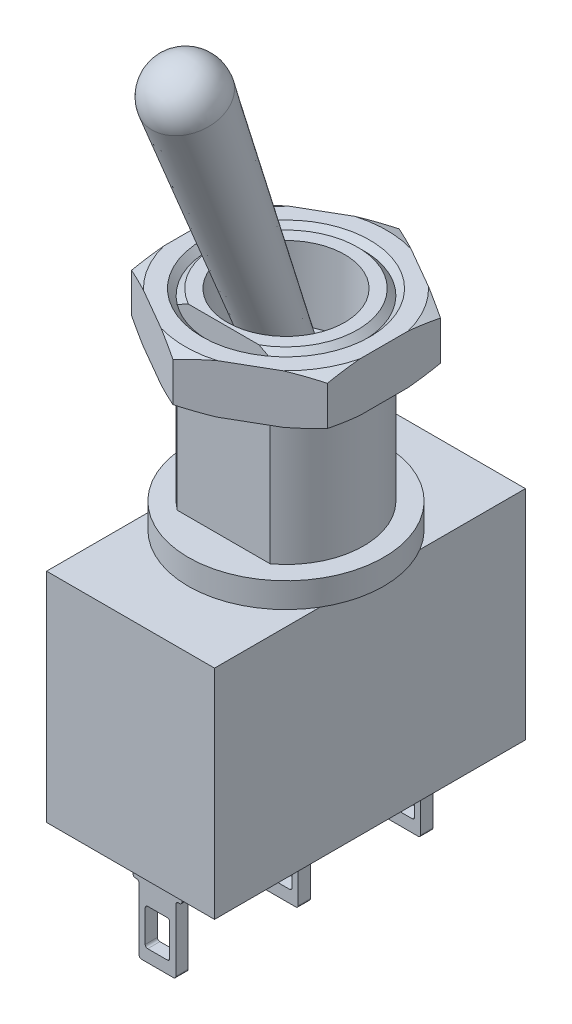
from build123d import *

# Parameters (mm, degrees)
EXTRUDE1_DEPTH             = 3.43
EXTRUDE1_DEPTH_BACK        = 3.43
SKETCH1_W                  = 12.7
SKETCH1_H                  = 8.89
SKETCH2_R                  = 3.99
EXTRUDE2_DEPTH             = 1.02
SKETCH3_R                  = 3.175
EXTRUDE3_DEPTH             = 7.52
CHAMFER1_SIZE              = 0.25
SKETCH7_R                  = 2.4
CUT_EXTRUDE2_DEPTH         = 3
SKETCH4_W                  = 3.796630084
SKETCH4_H                  = 2.50209529
CUT_EXTRUDE1_DEPTH         = 7.52
SKETCH6_R                  = 1.46
SKETCH5_R                  = 1
DOME1_FACE_RADIUS          = 1.46
DOME1_HEIGHT               = 1.46
EXTRUDE4_START             = -2
EXTRUDE4_DEPTH             = 2
CHAMFER2_SIZE              = 0.25
SKETCH10_W                 = 1
SKETCH10_H                 = 1.5
BOSS_EXTRUDE1_DEPTH        = 0.25
FILLET1_R                  = 0.1
LPATTERN1_COUNT            = 2
LPATTERN1_PITCH            = 5
FILLET1_OF_LPATTERN1_R     = 0.1
LPATTERN1_COL_COUNT        = 2
LPATTERN1_COL_PITCH        = 5
FILLET1_OF_LPATTERN1_COL_R = 0.1


with BuildPart() as part:
    # Sketch1 → Extrude1 (new, two sides: drawn at the far end of the back side and taken through both)
    with BuildSketch(Plane(origin=(0, 0, 0), x_dir=(0, 0, -1), z_dir=(1, 0, 0)).offset(-EXTRUDE1_DEPTH_BACK)):
        with Locations((0, 4.445)):
            Rectangle(SKETCH1_W, SKETCH1_H)
    extrude(amount=EXTRUDE1_DEPTH + EXTRUDE1_DEPTH_BACK)

    # Sketch2 → Extrude2 (add)
    with BuildSketch(Plane(origin=(0, 8.89, 0), x_dir=(1, 0, 0), z_dir=(0, 1, 0))):
        with Locations(Location((0, 0, 0), (0, 0, 30.722790779))):
            Circle(SKETCH2_R)
    extrude(amount=EXTRUDE2_DEPTH)

    # Sketch3 → Extrude3 (add)
    with BuildSketch(Plane(origin=(0, 9.91, 0), x_dir=(1, 0, 0), z_dir=(0, 1, 0))):
        with Locations(Location((0, 0, 0), (0, 0, 270))):
            Circle(SKETCH3_R)
    extrude(amount=EXTRUDE3_DEPTH)

    # Chamfer1
    chamfer1_edges = [part.edges().sort_by_distance(p)[0] for p in [
        (0, 17.43, -3.175),
    ]]
    chamfer(chamfer1_edges, length=CHAMFER1_SIZE)

    # Sketch7 → Cut-Extrude2 (cut)
    with BuildSketch(Plane(origin=(0, 17.43, 0), x_dir=(1, 0, 0), z_dir=(0, 1, 0))):
        with Locations(Location((0, 0, 0), (0, 0, 270))):
            Circle(SKETCH7_R)
    extrude(amount=-CUT_EXTRUDE2_DEPTH, mode=Mode.SUBTRACT)

    # Sketch4 → Cut-Extrude1 (cut)
    with BuildSketch(Plane(origin=(0, 17.43, 0), x_dir=(1, 0, 0), z_dir=(0, 1, 0))):
        with Locations((0, -3.796047645)):
            Rectangle(SKETCH4_W, SKETCH4_H)
    extrude(amount=-CUT_EXTRUDE1_DEPTH, mode=Mode.SUBTRACT)

    # Sketch8 → Extrude4 (add)
    with BuildSketch(Plane(origin=(0, 17.43, 0), x_dir=(1, 0, 0), z_dir=(0, 1, 0)).offset(EXTRUDE4_START)):
        Polygon((0, 4.618802154), (-4, 2.309401077), (-4, -2.309401077), (0, -4.618802154), (4, -2.309401077), (4, 2.309401077), align=None)
        with BuildLine():
            ThreePointArc((1.898315042, -2.545), (0, 3.175), (-1.898315042, -2.545))
            ThreePointArc((-1.898315042, -2.545), (0, -3.175), (1.898315042, -2.545))
        make_face(mode=Mode.SUBTRACT)
    extrude(amount=EXTRUDE4_DEPTH)

    # Chamfer2
    chamfer2_edges = [part.edges().sort_by_distance(p)[0] for p in [
        (1.898315042, 17.43, -2.545),
    ]]
    chamfer(chamfer2_edges, length=CHAMFER2_SIZE - 0.0001)  # a hair under: the kernel refuses the full size

    # Sketch9 → Cut-Revolve1 (revolve, cut)
    with BuildSketch(Plane(origin=(0, 0, 0), x_dir=(0, 0, -1), z_dir=(1, 0, 0)), mode=Mode.PRIVATE) as cut_revolve1_sk:
        Polygon((4.118802154, 17.43), (4.618802154, 17.43), (4.618802154, 17.23), align=None)
        Polygon((4.118802154, 15.43), (4.618802154, 15.63), (4.618802154, 15.43), align=None)
    revolve(cut_revolve1_sk.sketch.rotate(Axis((0, 29.123127022, 0), (0, -1, 0)), 180), axis=Axis((0, 29.123127022, 0), (0, -1, 0)), mode=Mode.SUBTRACT)

    # Sketch10 → Boss-Extrude1 (add, symmetric)
    with BuildSketch(Plane.XY):
        Polygon((-1, 0), (1, 0), (1, -1.25), (0.75, -1.25), (0.75, -4), (-0.75, -4), (-0.75, -1.25), (-1, -1.25), align=None)
        with Locations((0, -2.75)):
            Rectangle(SKETCH10_W, SKETCH10_H, mode=Mode.SUBTRACT)
    boss_extrude1 = extrude(amount=BOSS_EXTRUDE1_DEPTH, both=True)

    # Fillet1
    fillet1_edges = [part.edges().sort_by_distance(p)[0] for p in [
        (-1, -1.25, 0),
        (-0.75, -1.25, 0),
        (-0.75, -4, 0),
        (0.75, -4, 0),
        (0.75, -1.25, 0),
        (1, -1.25, 0),
        (-0.5, -3.5, 0),
        (0.5, -3.5, 0),
        (0.5, -2, 0),
        (-0.5, -2, 0),
    ]]
    fillet(fillet1_edges, radius=FILLET1_R)

    # LPattern1: Boss-Extrude1 ×2
    with Locations(*[(0, 0, -i * LPATTERN1_PITCH) for i in range(1, LPATTERN1_COUNT)]):
        add(boss_extrude1)

    # Fillet1 of LPattern1
    fillet1_of_lpattern1_edges = [part.edges().sort_by_distance(p)[0] for p in [
        (-1, -1.25, -5),
        (-0.75, -1.25, -5),
        (-0.75, -4, -5),
        (0.75, -4, -5),
        (0.75, -1.25, -5),
        (1, -1.25, -5),
        (-0.5, -3.5, -5),
        (0.5, -3.5, -5),
        (0.5, -2, -5),
        (-0.5, -2, -5),
    ]]
    fillet(fillet1_of_lpattern1_edges, radius=FILLET1_OF_LPATTERN1_R)

    # LPattern1 col: Boss-Extrude1 ×2
    with Locations(*[(0, 0, i * LPATTERN1_COL_PITCH) for i in range(1, LPATTERN1_COL_COUNT)]):
        add(boss_extrude1)

    # Fillet1 of LPattern1 col
    fillet1_of_lpattern1_col_edges = [part.edges().sort_by_distance(p)[0] for p in [
        (-1, -1.25, 5),
        (-0.75, -1.25, 5),
        (-0.75, -4, 5),
        (0.75, -4, 5),
        (0.75, -1.25, 5),
        (1, -1.25, 5),
        (-0.5, -3.5, 5),
        (0.5, -3.5, 5),
        (0.5, -2, 5),
        (-0.5, -2, 5),
    ]]
    fillet(fillet1_of_lpattern1_col_edges, radius=FILLET1_OF_LPATTERN1_COL_R)


with BuildPart() as body_2:
    # Sketch6 → Loft1 section 0
    with BuildSketch(Plane(origin=(0, 24.521644773, 8.925148793), x_dir=(1, 0, 0), z_dir=(0, -0.9396926207859105, -0.3420201433256629))):
        with Locations((0, -5.13030215)):
            Circle(SKETCH6_R)
    # Sketch5 → Loft1 section 1
    with BuildSketch(Plane(origin=(0, 13.245333323, 4.820907073), x_dir=(1, 0, 0), z_dir=(0, -0.9396926207859105, -0.3420201433256629))):
        with Locations((0, -5.13030215)):
            Circle(SKETCH5_R)
    loft()

    # Dome1: a dome of height H over a round flat face of radius A is a cap of a sphere of radius (A * A + H * H) / (2 * H)
    dome1_r = (DOME1_FACE_RADIUS * DOME1_FACE_RADIUS + DOME1_HEIGHT * DOME1_HEIGHT) / (2 * DOME1_HEIGHT)
    dome1_base = Plane((0, 26.276311449, 4.10424172), z_dir=(0, 0.939692620786, 0.342020143326))
    with Locations(dome1_base.offset(DOME1_HEIGHT - dome1_r)):
        dome1_ball = Sphere(dome1_r, mode=Mode.PRIVATE)
    add(split(dome1_ball, bisect_by=dome1_base, keep=Keep.TOP, mode=Mode.PRIVATE))


solid = Compound([part.part, body_2.part])
